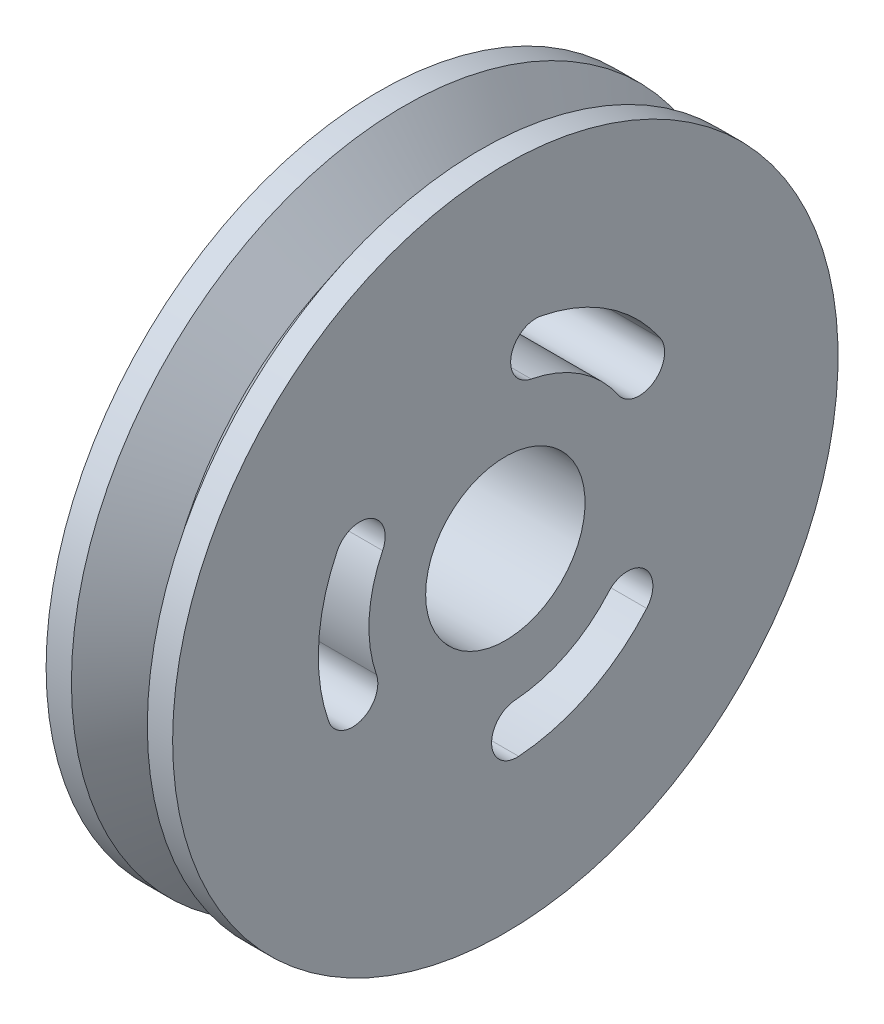
from build123d import *

# Parameters (mm, degrees)
CUT_EXTRUDE1_DEPTH      = 25.4561342
CUT_EXTRUDE1_DEPTH_BACK = 25.4561342


with BuildPart() as part:
    # Sketch1 → Revolve1 (revolve)
    with BuildSketch(Plane.XY):
        Polygon((1.27, 16.7), (3.175, 14.16), (5.08, 16.7), (6.35, 16.7), (6.35, 4), (0, 4), (0, 16.7), align=None)
    revolve(axis=Axis((0, 0, 0), (1, 0, 0)))

    # Sketch2 → Cut-Extrude1 (cut, two sides: drawn at the far end of the back side and taken through both)
    with BuildSketch(Plane.ZY.offset(-CUT_EXTRUDE1_DEPTH_BACK)):
        with BuildLine():
            ThreePointArc((-5.174909183, -4.484253783), (-6.966386671, -4.35615846), (-7.094481994, -6.147635947))
            ThreePointArc((-7.094481994, -6.147635947), (-4.201848283, -8.394615745), (-0.669521261, -9.363591393))
            ThreePointArc((-0.669521261, -9.363591393), (0.68782169, -8.187402585), (-0.488367118, -6.830059633))
            ThreePointArc((-0.488367118, -6.830059633), (-3.064943048, -6.123262297), (-5.174909183, -4.484253783))
        make_face()
        with BuildLine():
            ThreePointArc((-1.296023102, 6.723729705), (-0.289350554, 8.211147058), (-1.776767907, 9.217819606))
            ThreePointArc((-1.776767907, 9.217819606), (-5.169026349, 7.836215228), (-7.774347387, 5.261618116))
            ThreePointArc((-7.774347387, 5.261618116), (-7.434409475, 3.498030234), (-5.670821594, 3.837968146))
            ThreePointArc((-5.670821594, 3.837968146), (-3.77042918, 5.715949688), (-1.296023102, 6.723729705))
        make_face()
        with BuildLine():
            ThreePointArc((6.470932283, -2.239475924), (7.255737223, -3.8549886), (8.871249899, -3.07018366))
            ThreePointArc((8.871249899, -3.07018366), (9.37087463, 0.558400517), (8.443868646, 4.101973276))
            ThreePointArc((8.443868646, 4.101973276), (6.746587783, 4.689372349), (6.159188709, 2.992091486))
            ThreePointArc((6.159188709, 2.992091486), (6.835372226, 0.407312607), (6.470932283, -2.239475924))
        make_face()
    extrude(amount=CUT_EXTRUDE1_DEPTH + CUT_EXTRUDE1_DEPTH_BACK, mode=Mode.SUBTRACT)


solid = part.part
